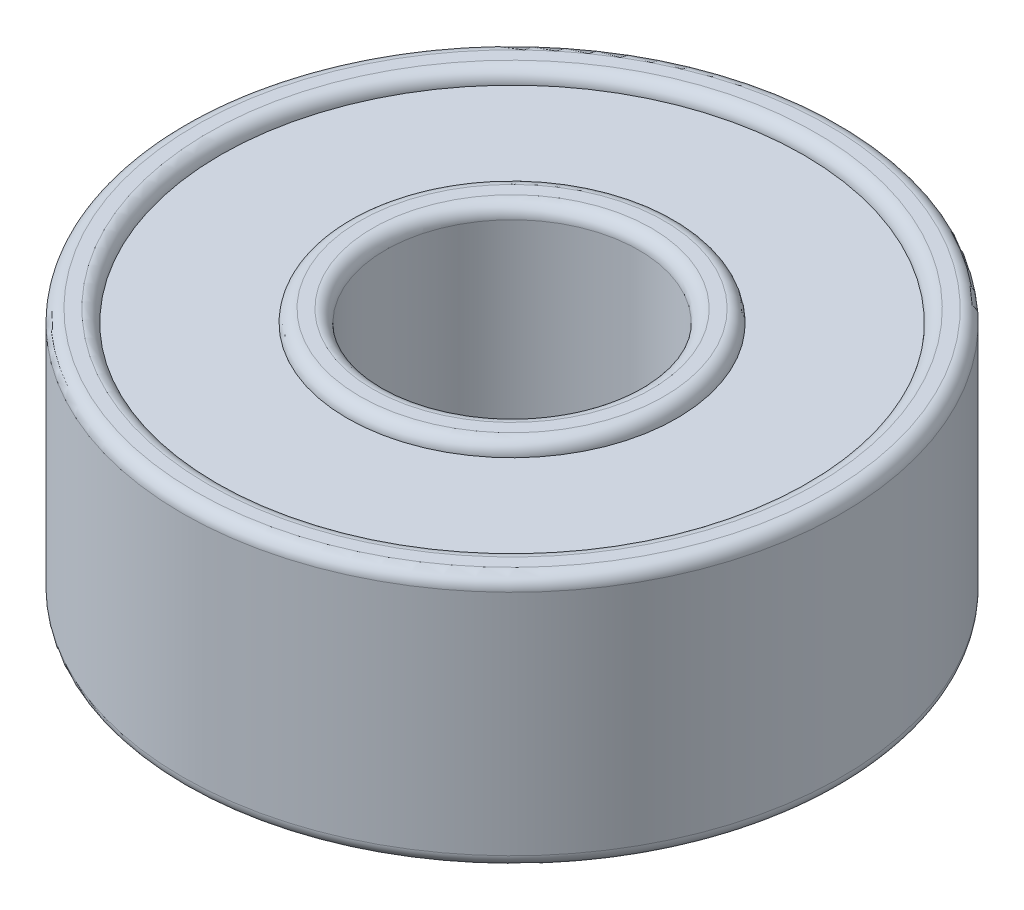
from build123d import *

# Parameters (mm, degrees)
SKETCH_1_R          = 6.5
SKETCH_1_R_2        = 2.5
EXTRUDE_1_DEPTH     = 2.5
SKETCH_2_R          = 5.75
SKETCH_2_R_2        = 3.25
CUT_EXTRUDE_1_DEPTH = 0.25
FILLET_1_R          = 0.25


with BuildPart() as part:
    # ｽｹｯﾁ1 → ﾎﾞｽ - 押し出し1 (new, symmetric)
    with BuildSketch(Plane(origin=(0, 0, 0), x_dir=(1, 0, 0), z_dir=(0, 1, 0))):
        with Locations(Location((0, 0, 0), (0, 0, 270))):
            Circle(SKETCH_1_R)
        with Locations(Location((0, 0, 0), (0, 0, 270))):
            Circle(SKETCH_1_R_2, mode=Mode.SUBTRACT)
    extrude(amount=EXTRUDE_1_DEPTH, both=True)

    # ｽｹｯﾁ2 → ｶｯﾄ - 押し出し1 (cut, symmetric)
    with BuildSketch(Plane(origin=(0, 2.5, 0), x_dir=(1, 0, 0), z_dir=(0, 1, 0))):
        Circle(SKETCH_2_R)
        Circle(SKETCH_2_R_2, mode=Mode.SUBTRACT)
    cut_extrude_1 = extrude(amount=CUT_EXTRUDE_1_DEPTH, both=True, mode=Mode.SUBTRACT)

    # ﾐﾗｰ1: ｶｯﾄ - 押し出し1 across plane
    add(cut_extrude_1.mirror(Plane.ZX), mode=Mode.SUBTRACT)

    # ﾌｨﾚｯﾄ1
    fillet_1_edges = [part.edges().sort_by_distance(p)[0] for p in [
        (0, -2.5, -6.5),
        (0, 2.5, -6.5),
        (-5.75, -2.5, 0),
        (-5.75, 2.5, 0),
        (-3.25, -2.5, 0),
        (-3.25, 2.5, 0),
        (0, -2.5, -2.5),
        (0, 2.5, -2.5),
    ]]
    fillet(fillet_1_edges, radius=FILLET_1_R - 0.0001)  # a hair under: the kernel refuses the full size


solid = part.part
